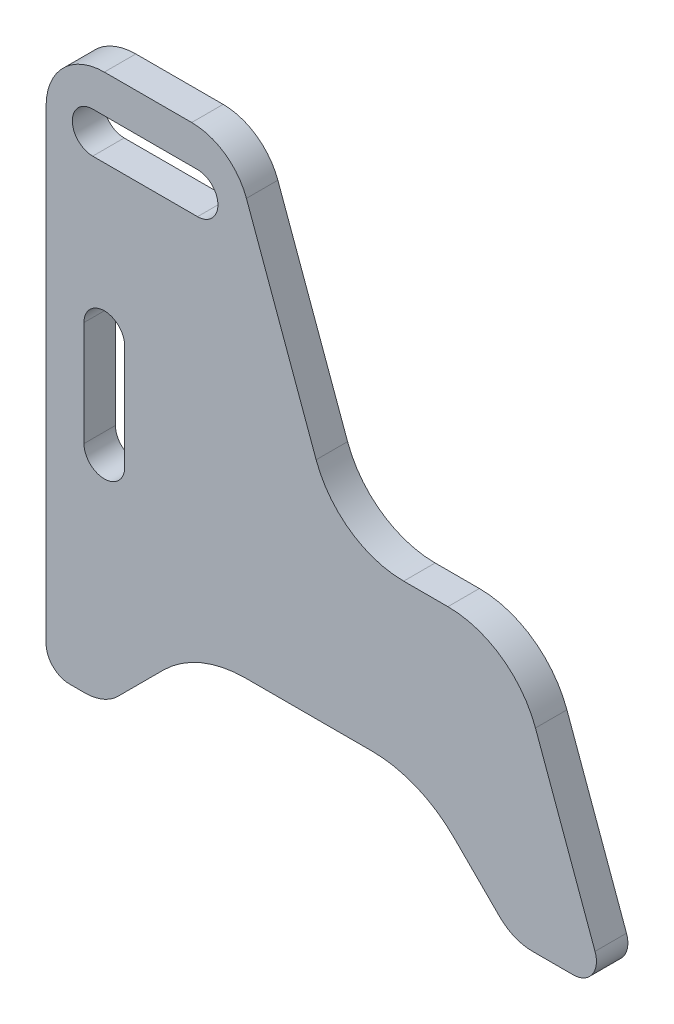
from build123d import *

# Parameters (mm, degrees)
BOSS_EXTRU_1_DEPTH           = 27
ENL_V_MAT_EXTRU_1_DEPTH      = 674.092494445
ENL_V_MAT_EXTRU_1_DEPTH_BACK = 674.092494445
CONG_3_R                     = 80
CONG_4_R                     = 50
CONG_5_R                     = 100
CONG_6_R                     = 20
CONG_7_R                     = 40
ENL_V_MAT_EXTRU_2_DEPTH      = 667.999349498
ENL_V_MAT_EXTRU_2_DEPTH_BACK = 667.999349498


with BuildPart() as part:
    # Esquisse1 → Boss.-Extru.1 (new body)
    with BuildSketch(Plane.XY):
        Polygon((0, 0), (0, 470), (160, 470), (250.992558567, 220), (400.992558567, 220), (481.066010105, 0), align=None)
    extrude(amount=BOSS_EXTRU_1_DEPTH)

    # Esquisse2 → Enlèv. mat.-Extru.1 (cut, two sides: drawn at the far end of the back side and taken through both)
    with BuildSketch(Plane.XY.offset(27).offset(-ENL_V_MAT_EXTRU_1_DEPTH_BACK)):
        Polygon((50, 0), (130, 80), (321.066010105, 80), (401.066010105, 0), align=None)
    extrude(amount=ENL_V_MAT_EXTRU_1_DEPTH + ENL_V_MAT_EXTRU_1_DEPTH_BACK, mode=Mode.SUBTRACT)

    # Congé3
    cong_3_edges = [part.edges().sort_by_distance(p)[0] for p in [
        (400.992558567, 220, 13.5),
        (250.992558567, 220, 13.5),
    ]]
    fillet(cong_3_edges, radius=CONG_3_R)

    # Congé4
    cong_4_edges = [part.edges().sort_by_distance(p)[0] for p in [
        (0, 470, 13.5),
        (160, 470, 13.5),
    ]]
    fillet(cong_4_edges, radius=CONG_4_R)

    # Congé5
    cong_5_edges = [part.edges().sort_by_distance(p)[0] for p in [
        (321.066010105, 80, 13.5),
        (130, 80, 13.5),
    ]]
    fillet(cong_5_edges, radius=CONG_5_R)

    # Congé6
    cong_6_edges = [part.edges().sort_by_distance(p)[0] for p in [
        (0, 0, 13.5),
        (481.066010105, 0, 13.5),
    ]]
    fillet(cong_6_edges, radius=CONG_6_R)

    # Congé7
    cong_7_edges = [part.edges().sort_by_distance(p)[0] for p in [
        (401.066010105, 0, 13.5),
        (50, 0, 13.5),
    ]]
    fillet(cong_7_edges, radius=CONG_7_R)

    # Esquisse3 → Enlèv. mat.-Extru.2 (cut, two sides: drawn at the far end of the back side and taken through both)
    with BuildSketch(Plane.XY.offset(27).offset(-ENL_V_MAT_EXTRU_2_DEPTH_BACK)):
        with BuildLine():
            Line((40, 437.5), (130, 437.5))
            ThreePointArc((130, 437.5), (147.5, 420), (130, 402.5))
            Line((130, 402.5), (40, 402.5))
            ThreePointArc((40, 402.5), (22.5, 420), (40, 437.5))
        make_face()
        with BuildLine():
            Line((67.5, 275), (67.5, 185))
            ThreePointArc((67.5, 185), (50, 167.5), (32.5, 185))
            Line((32.5, 185), (32.5, 275))
            ThreePointArc((32.5, 275), (50, 292.5), (67.5, 275))
        make_face()
    extrude(amount=ENL_V_MAT_EXTRU_2_DEPTH + ENL_V_MAT_EXTRU_2_DEPTH_BACK, mode=Mode.SUBTRACT)


solid = part.part
